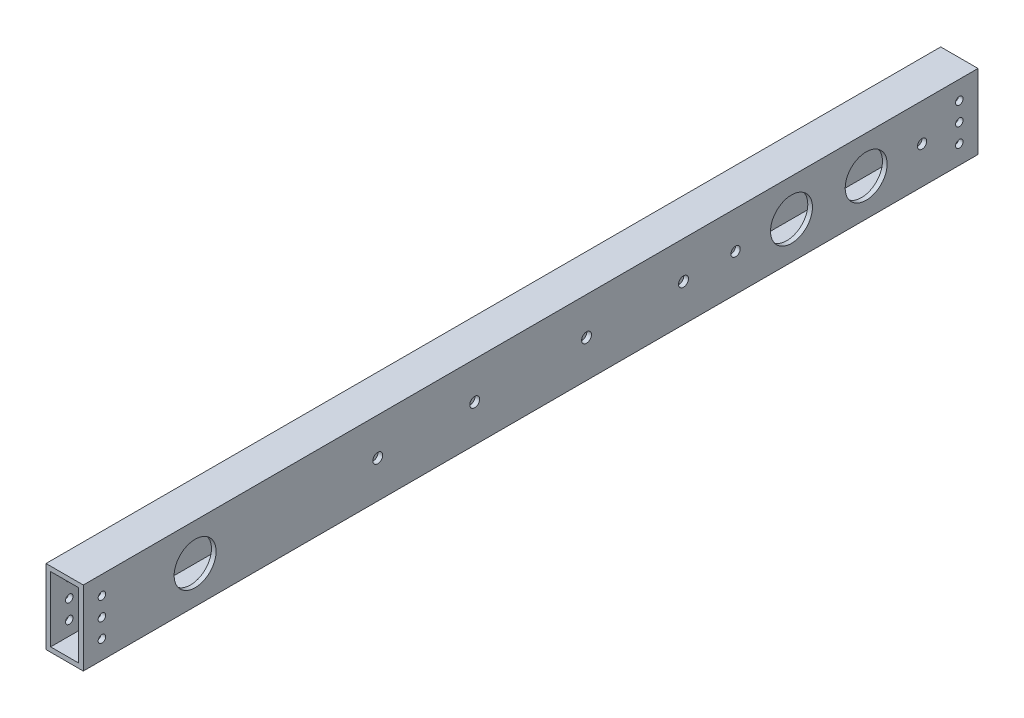
from build123d import *

# Parameters (mm, degrees)
SKETCH1_W               = 25.4
SKETCH1_H               = 50.8
SKETCH1_W_2             = 19.05
SKETCH1_H_2             = 44.45
BOSS_EXTRUDE1_DEPTH     = 304.8
F_10_CLEARANCE_HOLE1_D  = 5.1054
F_1_4_CLEARANCE_HOLE2_D = 6.7564
SKETCH7_R               = 14.2875
SKETCH7_R_2             = 3.175
CUT_EXTRUDE1_DEPTH      = 307.909367729


with BuildPart() as part:
    # Sketch1 → Boss-Extrude1 (new, symmetric)
    with BuildSketch(Plane.XY):
        Rectangle(SKETCH1_W, SKETCH1_H)
        Rectangle(SKETCH1_W_2, SKETCH1_H_2, mode=Mode.SUBTRACT)
    extrude(amount=BOSS_EXTRUDE1_DEPTH, both=True)

    # #10 Clearance Hole1 (through all)
    with Locations(Plane(origin=(12.7, 0, 0), x_dir=(0, 0, -1), z_dir=(1, 0, 0))):
        with Locations((-292.1, 12.7), (-292.1, 0), (-292.1, -12.7)):
            f_10_clearance_hole1 = Hole(F_10_CLEARANCE_HOLE1_D / 2)

    # Mirror1: #10 Clearance Hole1 across plane
    add(f_10_clearance_hole1.mirror(Plane.XY), mode=Mode.SUBTRACT)

    # 1/4 Clearance Hole2 (through all)
    with Locations(Plane(origin=(12.7, 0, 0), x_dir=(0, 0, -1), z_dir=(1, 0, 0))):
        with Locations((-38.1, 0), (38.1, 0), (-104.14, 0), (104.14, 0)):
            Hole(F_1_4_CLEARANCE_HOLE2_D / 2)

    # Sketch7 → Cut-Extrude1 (cut, through all)
    with BuildSketch(Plane(origin=(12.7, 0, 0), x_dir=(0, 0, -1), z_dir=(1, 0, 0))):
        with Locations((-228.6, 0)):
            Circle(SKETCH7_R)
        with Locations((177.7238, 0)):
            Circle(SKETCH7_R)
        with Locations((228.6, 0)):
            Circle(SKETCH7_R)
        with Locations((139.6238, 0)):
            Circle(SKETCH7_R_2)
        with Locations((266.7, 0)):
            Circle(SKETCH7_R_2)
    extrude(amount=-CUT_EXTRUDE1_DEPTH, mode=Mode.SUBTRACT)


solid = part.part
